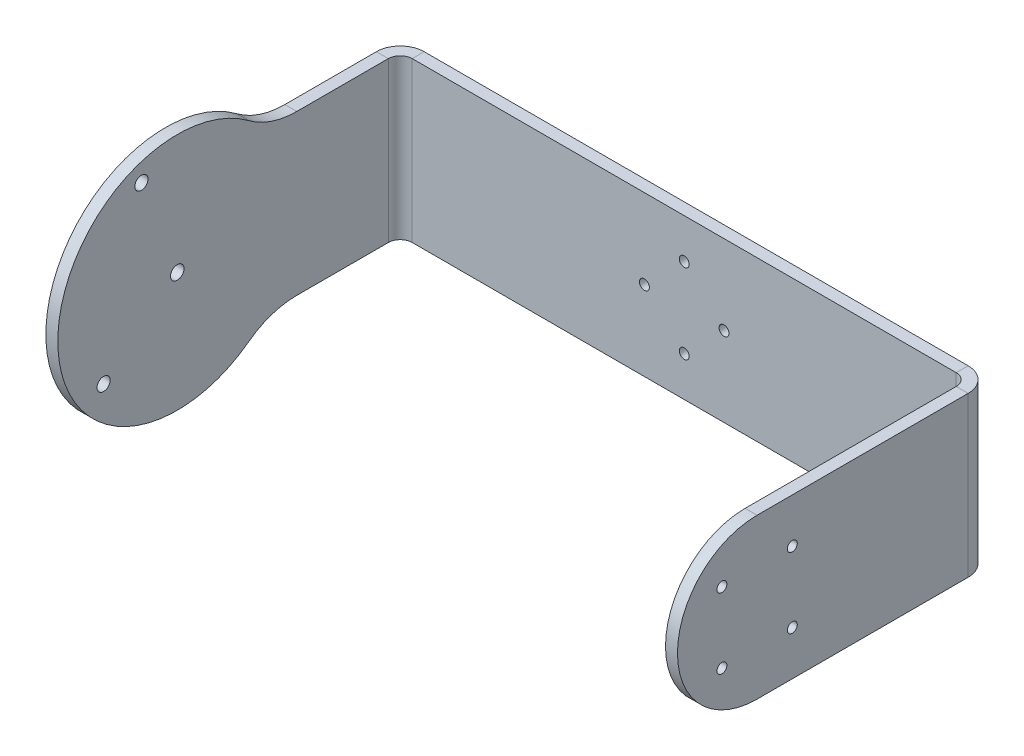
from build123d import *

# Parameters (mm, degrees)
ESQUISSE1_W                           = 142.6
ESQUISSE1_H                           = 40
T_LE_DE_BASE_PLI_E1_DEPTH             = 3
T_LE_PLI_E_SUR_AR_TE1_STRIP_W         = 18
T_LE_PLI_E_SUR_AR_TE1_STRIP_H         = 3
T_LE_PLI_E_SUR_AR_TE1_STRIP_CUT_DEPTH = 40
T_LE_PLI_E_SUR_AR_TE1_DEPTH           = 40
T_LE_PLI_E_SUR_AR_TE2_STRIP_W         = 18
T_LE_PLI_E_SUR_AR_TE2_STRIP_H         = 3
T_LE_PLI_E_SUR_AR_TE2_STRIP_CUT_DEPTH = 40
T_LE_PLI_E_SUR_AR_TE2_DEPTH           = 40
ENL_V_MAT_EXTRU_1_REACH               = 97.166
ESQUISSE14_R                          = 1.25
PATTE1_DEPTH                          = 3
ENL_V_MAT_EXTRU_2_REACH               = 170.101
ESQUISSE19_R                          = 1.25
PATTE2_START                          = -3
PATTE2_DEPTH                          = 3
ENL_V_MAT_EXTRU_3_REACH               = 170.101
ESQUISSE24_R                          = 1.7
ESQUISSE25_R                          = 30
ESQUISSE25_R_2                        = 1.65
ESQUISSE25_R_3                        = 1.7
BOSS_EXTRU_1_DEPTH                    = 3
CONG_1_R                              = 20


# Sheet-metal steps are written as plain solids
with BuildPart() as part:
    # Esquisse1 → Tôle de base pliée1 (new body)
    with BuildSketch(Plane.XY):
        Rectangle(ESQUISSE1_W, ESQUISSE1_H)
    extrude(amount=-T_LE_DE_BASE_PLI_E1_DEPTH)

    # Tôle pliée sur arête1 strip (across the edge) → Tôle pliée sur arête1 strip cut (cut)
    with BuildSketch(Plane(origin=(-71.3, 20, 0), x_dir=(1, 0, 0), z_dir=(0, -1, 0))):
        with Locations((-6, -1.5)):
            Rectangle(T_LE_PLI_E_SUR_AR_TE1_STRIP_W, T_LE_PLI_E_SUR_AR_TE1_STRIP_H)
    extrude(amount=T_LE_PLI_E_SUR_AR_TE1_STRIP_CUT_DEPTH, mode=Mode.SUBTRACT)

    # Tôle pliée sur arête1 section (across the edge) → Tôle pliée sur arête1 (add)
    with BuildSketch(Plane(origin=(-71.3, 20, 0), x_dir=(1, 0, 0), z_dir=(0, -1, 0))):
        with BuildLine():
            Line((-3, 3), (-3, 56))
            Line((-3, 56), (0, 56))
            Line((0, 56), (0, 3))
            ThreePointArc((0, 3), (0.878679656, 0.878679656), (3, 0))
            Line((3, 0), (3, -3))
            ThreePointArc((3, -3), (-1.242640687, -1.242640687), (-3, 3))
        make_face()
    extrude(amount=T_LE_PLI_E_SUR_AR_TE1_DEPTH)

    # Tôle pliée sur arête2 strip (across the edge) → Tôle pliée sur arête2 strip cut (cut)
    with BuildSketch(Plane(origin=(71.3, -20, 0), x_dir=(-1, 0, 0), z_dir=(0, 1, 0))):
        with Locations((-6, -1.5)):
            Rectangle(T_LE_PLI_E_SUR_AR_TE2_STRIP_W, T_LE_PLI_E_SUR_AR_TE2_STRIP_H)
    extrude(amount=T_LE_PLI_E_SUR_AR_TE2_STRIP_CUT_DEPTH, mode=Mode.SUBTRACT)

    # Tôle pliée sur arête2 section (across the edge) → Tôle pliée sur arête2 (add)
    with BuildSketch(Plane(origin=(71.3, -20, 0), x_dir=(-1, 0, 0), z_dir=(0, 1, 0))):
        with BuildLine():
            Line((-3, 3), (-3, 56))
            Line((-3, 56), (0, 56))
            Line((0, 56), (0, 3))
            ThreePointArc((0, 3), (0.878679656, 0.878679656), (3, 0))
            Line((3, 0), (3, -3))
            ThreePointArc((3, -3), (-1.242640687, -1.242640687), (-3, 3))
        make_face()
    extrude(amount=T_LE_PLI_E_SUR_AR_TE2_DEPTH)

    # Esquisse14 → Enlèv. mat.-Extru.1 (cut, up to next)
    with BuildSketch(Plane.XY, mode=Mode.PRIVATE) as enl_v_mat_extru_1_sk1:
        with Locations((0, 10)):
            Circle(ESQUISSE14_R)
    enl_v_mat_extru_1_tool1 = extrude(enl_v_mat_extru_1_sk1.sketch, amount=-ENL_V_MAT_EXTRU_1_REACH, mode=Mode.PRIVATE) & part.part
    # Esquisse14 → Enlèv. mat.-Extru.1 (cut, up to next)
    with BuildSketch(Plane.XY, mode=Mode.PRIVATE) as enl_v_mat_extru_1_sk2:
        with Locations((10, 0)):
            Circle(ESQUISSE14_R)
    enl_v_mat_extru_1_tool2 = extrude(enl_v_mat_extru_1_sk2.sketch, amount=-ENL_V_MAT_EXTRU_1_REACH, mode=Mode.PRIVATE) & part.part
    # Esquisse14 → Enlèv. mat.-Extru.1 (cut, up to next)
    with BuildSketch(Plane.XY, mode=Mode.PRIVATE) as enl_v_mat_extru_1_sk3:
        with Locations((0, -10)):
            Circle(ESQUISSE14_R)
    enl_v_mat_extru_1_tool3 = extrude(enl_v_mat_extru_1_sk3.sketch, amount=-ENL_V_MAT_EXTRU_1_REACH, mode=Mode.PRIVATE) & part.part
    # Esquisse14 → Enlèv. mat.-Extru.1 (cut, up to next)
    with BuildSketch(Plane.XY, mode=Mode.PRIVATE) as enl_v_mat_extru_1_sk4:
        with Locations((-10, 0)):
            Circle(ESQUISSE14_R)
    enl_v_mat_extru_1_tool4 = extrude(enl_v_mat_extru_1_sk4.sketch, amount=-ENL_V_MAT_EXTRU_1_REACH, mode=Mode.PRIVATE) & part.part
    add(enl_v_mat_extru_1_tool1.solids().sort_by_distance((0, 10, 0))[0], mode=Mode.SUBTRACT)
    add(enl_v_mat_extru_1_tool2.solids().sort_by_distance((10, 0, 0))[0], mode=Mode.SUBTRACT)
    add(enl_v_mat_extru_1_tool3.solids().sort_by_distance((0, -10, 0))[0], mode=Mode.SUBTRACT)
    add(enl_v_mat_extru_1_tool4.solids().sort_by_distance((-10, 0, 0))[0], mode=Mode.SUBTRACT)

    # Esquisse16 → Patte1 (add)
    with BuildSketch(Plane(origin=(74.3, 0, 0), x_dir=(0, 0, -1), z_dir=(1, 0, 0))):
        with BuildLine():
            Line((-56, 20), (-56, -20))
            ThreePointArc((-56, -20), (-76, 0), (-56, 20))
        make_face()
    extrude(amount=-PATTE1_DEPTH)

    # Esquisse19 → Enlèv. mat.-Extru.2 (cut, up to next)
    with BuildSketch(Plane(origin=(74.3, 0, 0), x_dir=(0, 0, -1), z_dir=(1, 0, 0)), mode=Mode.PRIVATE) as enl_v_mat_extru_2_sk1:
        with Locations((-64.838834765, 8.838834765)):
            Circle(ESQUISSE19_R)
    enl_v_mat_extru_2_tool1 = extrude(enl_v_mat_extru_2_sk1.sketch, amount=-ENL_V_MAT_EXTRU_2_REACH, mode=Mode.PRIVATE) & part.part
    # Esquisse19 → Enlèv. mat.-Extru.2 (cut, up to next)
    with BuildSketch(Plane(origin=(74.3, 0, 0), x_dir=(0, 0, -1), z_dir=(1, 0, 0)), mode=Mode.PRIVATE) as enl_v_mat_extru_2_sk2:
        with Locations((-47.161165235, 8.838834765)):
            Circle(ESQUISSE19_R)
    enl_v_mat_extru_2_tool2 = extrude(enl_v_mat_extru_2_sk2.sketch, amount=-ENL_V_MAT_EXTRU_2_REACH, mode=Mode.PRIVATE) & part.part
    # Esquisse19 → Enlèv. mat.-Extru.2 (cut, up to next)
    with BuildSketch(Plane(origin=(74.3, 0, 0), x_dir=(0, 0, -1), z_dir=(1, 0, 0)), mode=Mode.PRIVATE) as enl_v_mat_extru_2_sk3:
        with Locations((-47.161165235, -8.838834765)):
            Circle(ESQUISSE19_R)
    enl_v_mat_extru_2_tool3 = extrude(enl_v_mat_extru_2_sk3.sketch, amount=-ENL_V_MAT_EXTRU_2_REACH, mode=Mode.PRIVATE) & part.part
    # Esquisse19 → Enlèv. mat.-Extru.2 (cut, up to next)
    with BuildSketch(Plane(origin=(74.3, 0, 0), x_dir=(0, 0, -1), z_dir=(1, 0, 0)), mode=Mode.PRIVATE) as enl_v_mat_extru_2_sk4:
        with Locations((-64.838834765, -8.838834765)):
            Circle(ESQUISSE19_R)
    enl_v_mat_extru_2_tool4 = extrude(enl_v_mat_extru_2_sk4.sketch, amount=-ENL_V_MAT_EXTRU_2_REACH, mode=Mode.PRIVATE) & part.part
    add(enl_v_mat_extru_2_tool1.solids().sort_by_distance((74.3, 8.838835, 64.838835))[0], mode=Mode.SUBTRACT)
    add(enl_v_mat_extru_2_tool2.solids().sort_by_distance((74.3, 8.838835, 47.161165))[0], mode=Mode.SUBTRACT)
    add(enl_v_mat_extru_2_tool3.solids().sort_by_distance((74.3, -8.838835, 47.161165))[0], mode=Mode.SUBTRACT)
    add(enl_v_mat_extru_2_tool4.solids().sort_by_distance((74.3, -8.838835, 64.838835))[0], mode=Mode.SUBTRACT)

    # Esquisse20 → Patte2 (add)
    with BuildSketch(Plane.ZY.offset(74.3).offset(PATTE2_START)):
        with BuildLine():
            Line((56, 20), (56, -20))
            ThreePointArc((56, -20), (76, 0), (56, 20))
        make_face()
    extrude(amount=PATTE2_DEPTH)

    # Esquisse24 → Enlèv. mat.-Extru.3 (cut, up to next)
    with BuildSketch(Plane.ZY.offset(74.3), mode=Mode.PRIVATE) as enl_v_mat_extru_3_sk1:
        with Locations((56, 0)):
            Circle(ESQUISSE24_R)
    enl_v_mat_extru_3_tool1 = extrude(enl_v_mat_extru_3_sk1.sketch, amount=-ENL_V_MAT_EXTRU_3_REACH, mode=Mode.PRIVATE) & part.part
    add(enl_v_mat_extru_3_tool1.solids().sort_by_distance((-74.3, 0, 56))[0], mode=Mode.SUBTRACT)

    # Esquisse25 → Boss.-Extru.1 (add)
    with BuildSketch(Plane.ZY.offset(74.3)):
        with Locations((56, 0)):
            Circle(ESQUISSE25_R)
        with Locations((65, 24)):
            Circle(ESQUISSE25_R_2, mode=Mode.SUBTRACT)
        with Locations((74.5, -15)):
            Circle(ESQUISSE25_R_2, mode=Mode.SUBTRACT)
        with Locations((56, 0)):
            Circle(ESQUISSE25_R_3, mode=Mode.SUBTRACT)
    extrude(amount=-BOSS_EXTRU_1_DEPTH)

    # Congé1
    cong_1_edges = [part.edges().sort_by_distance(p)[0] for p in [
        (-72.8, 20, 33.639320225),
        (-72.8, -20, 33.639320225),
    ]]
    fillet(cong_1_edges, radius=CONG_1_R)


solid = part.part
